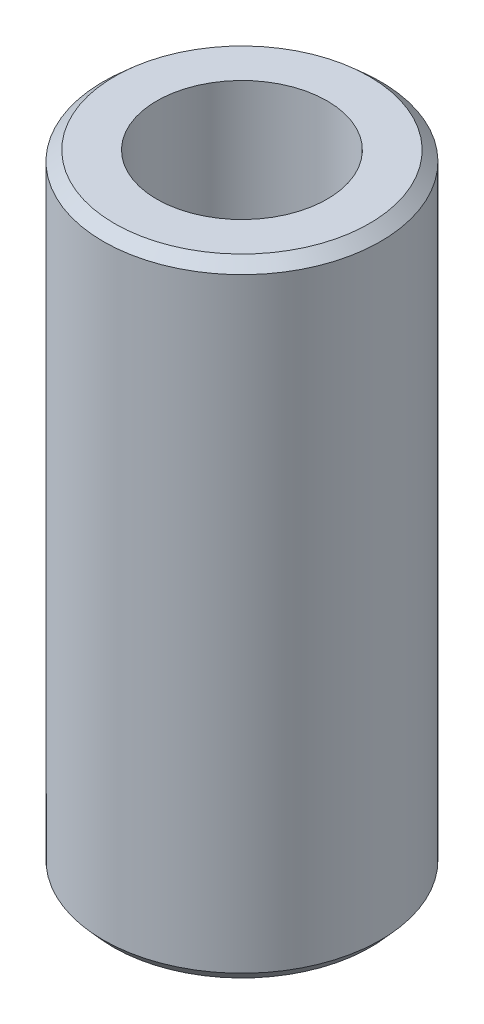
from build123d import *
from OCP.BRepFilletAPI import BRepFilletAPI_MakeChamfer

# Parameters (mm, degrees)
SKETCH1_R           = 20
BOSS_EXTRUDE1_DEPTH = 90.357373334
SKETCH2_R           = 12.294600779
CUT_EXTRUDE1_DEPTH  = 95.680805424
CHAMFER1_SIZE       = 1.438172857
CHAMFER1_SIZE2      = 1.610761543


with BuildPart() as part:
    # Sketch1 → Boss-Extrude1 (new body)
    with BuildSketch(Plane(origin=(0, 0, 0), x_dir=(1, 0, 0), z_dir=(0, 1, 0))):
        Circle(SKETCH1_R)
    extrude(amount=BOSS_EXTRUDE1_DEPTH)

    # Sketch2 → Cut-Extrude1 (cut, through all)
    with BuildSketch(Plane(origin=(0, 0, 0), x_dir=(1, 0, 0), z_dir=(0, 1, 0))):
        Circle(SKETCH2_R)
    extrude(amount=CUT_EXTRUDE1_DEPTH, mode=Mode.SUBTRACT)

    # Chamfer1: one chamfer whose edges measure the first distance from different faces: ONE call of the kernel's chamfer builder (chamfer() names one face for all edges)
    chamfer1_edges_1 = [part.edges().sort_by_distance(p)[0] for p in [
        (-20, 90.357373334, 0),
    ]]
    chamfer1_side_1 = [part.faces().sort_by_distance(p)[0] for p in [
        (-20, 45.178686667, 0),
    ]]
    chamfer1_edges_2 = [part.edges().sort_by_distance(p)[0] for p in [
        (-20, 0, 0),
    ]]
    chamfer1_side_2 = [part.faces().sort_by_distance(p)[0] for p in [
        (-19.434314575, 0, 0),
    ]]
    chamfer1 = BRepFilletAPI_MakeChamfer(part.part.solid().wrapped)
    for e in chamfer1_edges_1:
        chamfer1.Add(CHAMFER1_SIZE, CHAMFER1_SIZE2, e.wrapped, chamfer1_side_1[0].wrapped)  # the first distance lies on this face
    for e in chamfer1_edges_2:
        chamfer1.Add(CHAMFER1_SIZE, CHAMFER1_SIZE2, e.wrapped, chamfer1_side_2[0].wrapped)  # the first distance lies on this face
    add(Compound.cast(chamfer1.Shape()), mode=Mode.REPLACE)


solid = part.part
